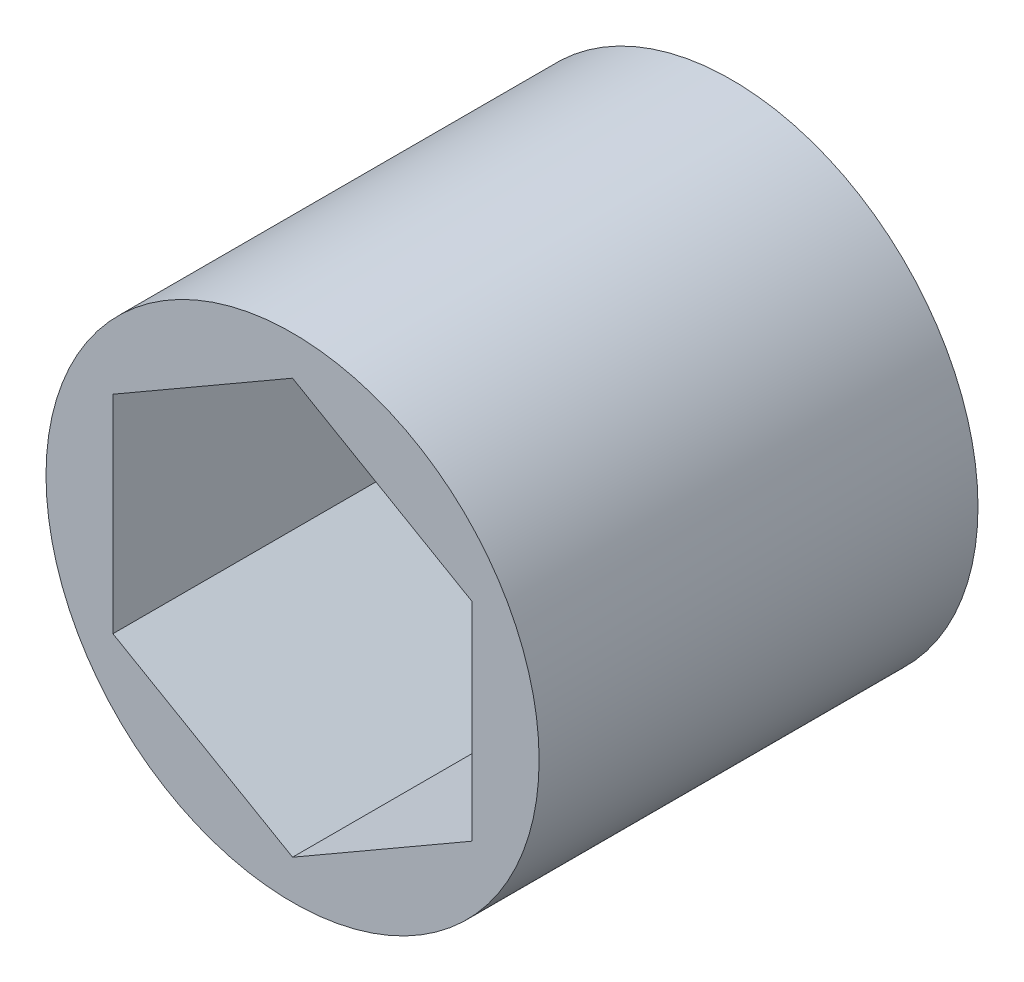
from build123d import *

# Parameters (mm, degrees)
SKETCH1_R           = 8.89
BOSS_EXTRUDE1_DEPTH = 15.8242


with BuildPart() as part:
    # Sketch1 → Boss-Extrude1 (new body)
    with BuildSketch(Plane.XY):
        Circle(SKETCH1_R)
        Polygon((0, 7.478995387), (-6.477, 3.739497694), (-6.477, -3.739497694), (0, -7.478995387), (6.477, -3.739497694), (6.477, 3.739497694), align=None, mode=Mode.SUBTRACT)
    extrude(amount=BOSS_EXTRUDE1_DEPTH)


solid = part.part
